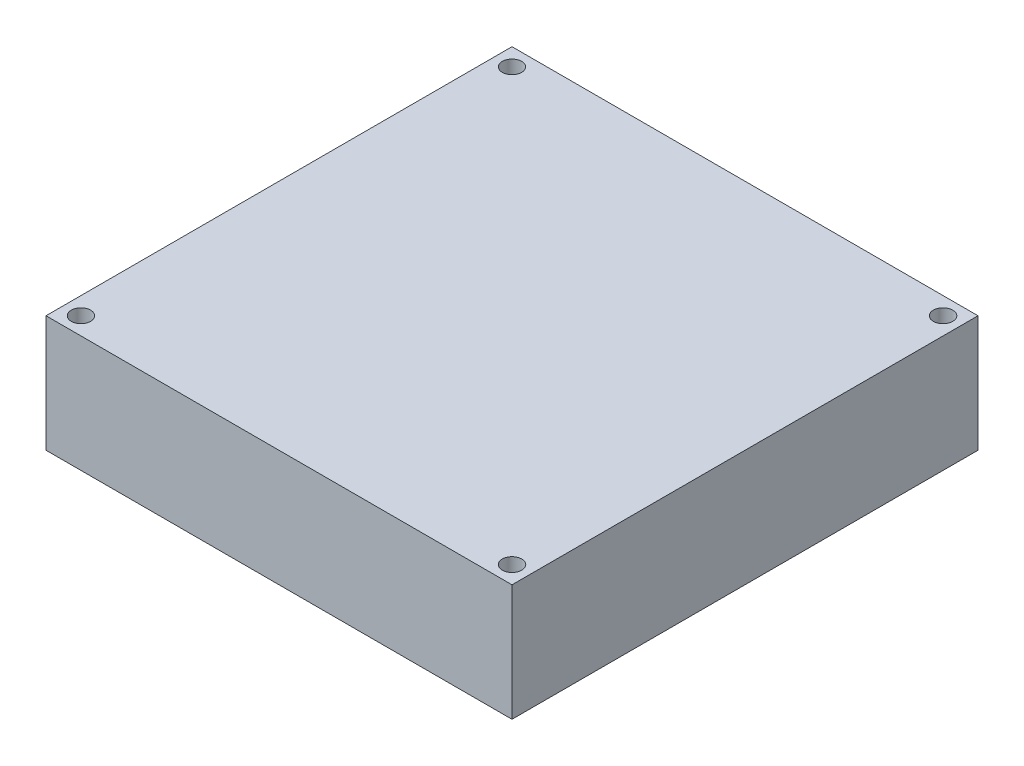
from build123d import *

# Parameters (mm, degrees)
SKETCH1_W           = 60
SKETCH1_H           = 60
BOSS_EXTRUDE1_DEPTH = 15
SKETCH3_R           = 1.237868738
SKETCH3_R_2         = 1.252521575
SKETCH3_R_3         = 1.248199839
SKETCH3_R_4         = 1.253619169
CUT_EXTRUDE1_DEPTH  = 87.168439698


with BuildPart() as part:
    # Sketch1 → Boss-Extrude1 (new body)
    with BuildSketch(Plane(origin=(0, 0, 0), x_dir=(1, 0, 0), z_dir=(0, 1, 0))):
        with Locations((-30, 30)):
            Rectangle(SKETCH1_W, SKETCH1_H)
    extrude(amount=BOSS_EXTRUDE1_DEPTH)

    # Sketch3 → Cut-Extrude1 (cut, through all)
    with BuildSketch(Plane(origin=(0, 15, 0), x_dir=(1, 0, 0), z_dir=(0, 1, 0))):
        with Locations((-57.75, 57.75)):
            Circle(SKETCH3_R)
        with Locations((-2.25, 57.75)):
            Circle(SKETCH3_R_2)
        with Locations((-57.75, 2.25)):
            Circle(SKETCH3_R_3)
        with Locations((-2.25, 2.25)):
            Circle(SKETCH3_R_4)
    extrude(amount=-CUT_EXTRUDE1_DEPTH, mode=Mode.SUBTRACT)


solid = part.part
